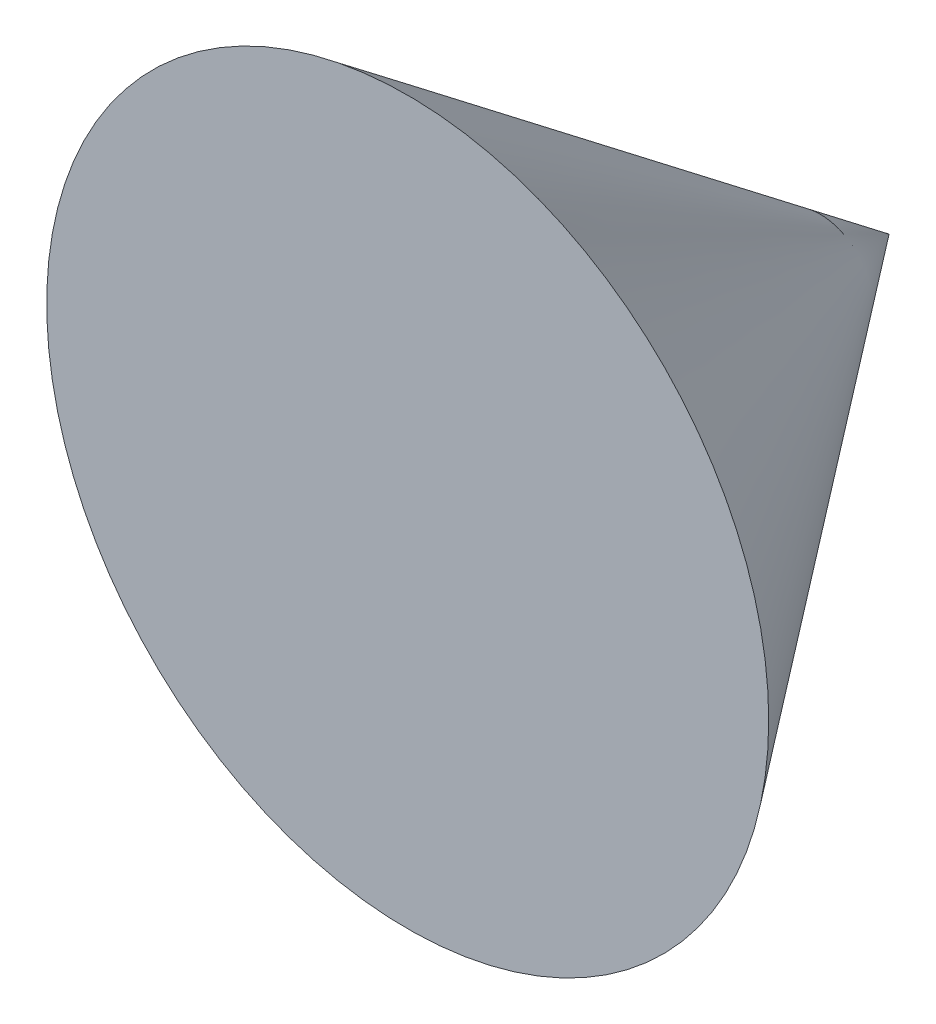
from build123d import *


with BuildPart() as part:
    # Sketch1 → Revolve1 (revolve)
    with BuildSketch(Plane(origin=(0, 0, 0), x_dir=(0, 0, -1), z_dir=(1, 0, 0))):
        Polygon((0, 0), (12, 0), (0, 9), align=None)
    revolve(axis=Axis((0, 0, 0), (0, 0, -1)))


solid = part.part
